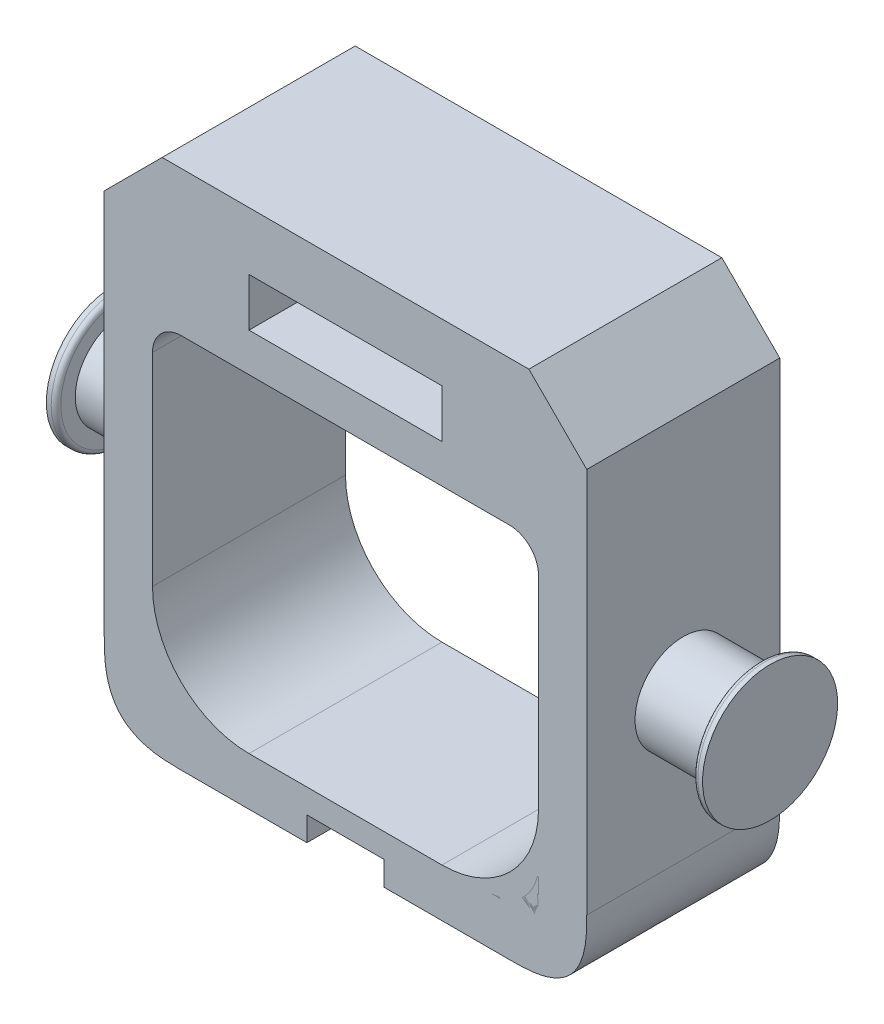
from build123d import *

# Parameters (mm, degrees)
SKETCH1_W            = 25
SKETCH1_H            = 27
SKETCH1_W_2          = 20
SKETCH1_H_2          = 17
BOSS_EXTRUDE1_DEPTH  = 10
FILLET1_SIZE         = 4
BOSS_EXTRUDE2_DEPTH  = 10
BOSS_EXTRUDE3_DEPTH  = 10
BOSS_EXTRUDE4_DEPTH  = 7.5
BOSS_EXTRUDE5_DEPTH  = 10
CHAMFER1_SIZE        = 3
SKETCH8_W            = 10
SKETCH8_H            = 2.5
CUT_EXTRUDE1_DEPTH   = 10.5
SKETCH19_W           = 4
SKETCH19_H           = 1.25
CUT_EXTRUDE5_DEPTH   = 32.408597715
SKETCH20_R           = 2.5
BOSS_EXTRUDE10_DEPTH = 4.5
SKETCH21_R           = 3.5
BOSS_EXTRUDE11_DEPTH = 0.5
FILLET2_R            = 0.25
FILLET3_R            = 0.25


with BuildPart() as part:
    # Sketch1 → Boss-Extrude1 (new body)
    with BuildSketch(Plane.XY):
        with Locations((-10, -6)):
            Rectangle(SKETCH1_W, SKETCH1_H)
        with Locations((-10, -8.5)):
            Rectangle(SKETCH1_W_2, SKETCH1_H_2, mode=Mode.SUBTRACT)
    extrude(amount=BOSS_EXTRUDE1_DEPTH)

    # Fillet1
    # a fillet whose section is not a circle: 4 mm, written as the material it takes off along each edge
    with BuildSketch(Plane(origin=(-22.5, -19.5, -10), x_dir=(0, 1, 0), z_dir=(0, 0, 1)), Plane(origin=(2.5, -19.5, -10), x_dir=(-1, 0, 0), z_dir=(0, 0, 1))) as fillet1_piece_1:
        with BuildLine():
            add(Edge.make_bspline([(FILLET1_SIZE, 0), (FILLET1_SIZE * 0.831801948466, 0), (FILLET1_SIZE * 0.663603896932, 0), (FILLET1_SIZE * 0.292893218813, -FILLET1_SIZE * 0.0716919198361), (FILLET1_SIZE * 0.0716919198361, -FILLET1_SIZE * 0.292893218813), (0, -FILLET1_SIZE * 0.663603896932), (0, -FILLET1_SIZE * 0.831801948466), (0, -FILLET1_SIZE)], knots=[0, 0, 0, 0, 0, 0, 0.5, 0.5, 1, 1, 1, 1, 1, 1], degree=5))
            Line((0, -FILLET1_SIZE), (0, 0))
            Line((0, 0), (FILLET1_SIZE, 0))
        make_face()
    extrude(amount=30, mode=Mode.SUBTRACT)

    # Sketch3 → Boss-Extrude2 (add)
    with BuildSketch(Plane.XY.offset(10)):
        with BuildLine():
            Line((-18.5, 0), (-20, 0))
            Line((-20, 0), (-20, -1.5))
            ThreePointArc((-20, -1.5), (-19.560660172, -0.439339828), (-18.5, 0))
        make_face()
    extrude(amount=-BOSS_EXTRUDE2_DEPTH)

    # Sketch4 → Boss-Extrude3 (add)
    with BuildSketch(Plane.XY.offset(10)):
        with BuildLine():
            Line((0, 0), (0, -1.495394009))
            ThreePointArc((0, -1.495394009), (-0.437990765, -0.437990765), (-1.495394009, 0))
            Line((-1.495394009, 0), (0, 0))
        make_face()
    extrude(amount=-BOSS_EXTRUDE3_DEPTH)

    # Sketch7 → Boss-Extrude5 (add)
    with BuildSketch(Plane.XY.offset(10)):
        with BuildLine():
            Line((-20, -17), (-15, -17))
            ThreePointArc((-15, -17), (-18.535533906, -15.535533906), (-20, -12))
            Line((-20, -12), (-20, -17))
        make_face()
        with BuildLine():
            Line((0, -17), (-5, -17))
            ThreePointArc((-5, -17), (-1.464466094, -15.535533906), (0, -12))
            Line((0, -12), (0, -17))
        make_face()
    extrude(amount=-BOSS_EXTRUDE5_DEPTH)

    # Chamfer1
    chamfer1_edges = [part.edges().sort_by_distance(p)[0] for p in [
        (2.5, 7.5, 5),
        (-22.5, 7.5, 5),
    ]]
    chamfer(chamfer1_edges, length=CHAMFER1_SIZE)

    # Sketch8 → Cut-Extrude1 (cut)
    with BuildSketch(Plane.XY.offset(10)):
        with Locations((-10, 3.25)):
            Rectangle(SKETCH8_W, SKETCH8_H)
    extrude(amount=-CUT_EXTRUDE1_DEPTH, mode=Mode.SUBTRACT)

    # Sketch19 → Cut-Extrude5 (cut, through all)
    with BuildSketch(Plane.XY.offset(10)):
        with Locations((-10, -18.875)):
            Rectangle(SKETCH19_W, SKETCH19_H)
    extrude(amount=-CUT_EXTRUDE5_DEPTH, mode=Mode.SUBTRACT)

    # Sketch20 → Boss-Extrude10 (add)
    with BuildSketch(Plane(origin=(2.5, 0, 0), x_dir=(0, 0, -1), z_dir=(1, 0, 0))):
        with Locations(Location((-5, -8, 0), (0, 0, 180))):
            Circle(SKETCH20_R)
    boss_extrude10 = extrude(amount=BOSS_EXTRUDE10_DEPTH)

    # Sketch21 → Boss-Extrude11 (add)
    with BuildSketch(Plane(origin=(7, 0, 0), x_dir=(0, 0, -1), z_dir=(1, 0, 0))):
        with Locations((-5, -8)):
            Circle(SKETCH21_R)
    boss_extrude11 = extrude(amount=-BOSS_EXTRUDE11_DEPTH)

    # Fillet2
    fillet2_edges = [part.edges().sort_by_distance(p)[0] for p in [
        (6.5, -8, 8.5),
    ]]
    fillet(fillet2_edges, radius=FILLET2_R)

    # Mirror1: Boss-Extrude10, Boss-Extrude11 across plane
    add(boss_extrude10.mirror(Plane.ZY.offset(10)))
    add(boss_extrude11.mirror(Plane.ZY.offset(10)))

    # Fillet3
    fillet3_edges = [part.edges().sort_by_distance(p)[0] for p in [
        (-26.5, -8, 8.5),
    ]]
    fillet(fillet3_edges, radius=FILLET3_R)


with BuildPart() as body_2:
    # Sketch6 → Boss-Extrude4 (new body)
    with BuildSketch(Plane.XY.offset(10)):
        with BuildLine():
            Line((0, -17), (0, -14.5))
            ThreePointArc((0, -14.5), (-0.732233047, -16.267766953), (-2.5, -17))
            Line((-2.5, -17), (0, -17))
        make_face()
    extrude(amount=-BOSS_EXTRUDE4_DEPTH)


solid = Compound([part.part, body_2.part])
